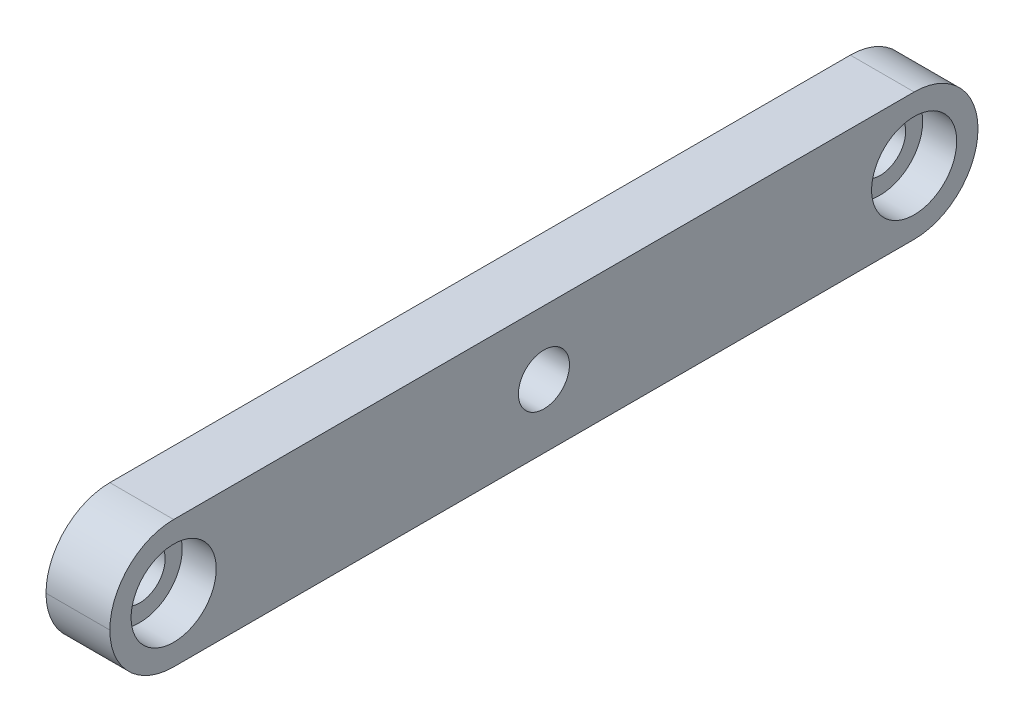
from build123d import *

# Parameters (mm, degrees)
SKETCH_1_W          = 20.4
SKETCH_1_H          = 3
SKETCH_1_R          = 0.6
EXTRUDE_1_DEPTH     = 1.5
FILLET_1_R          = 1.5
CUT_EXTRUDE_START   = 1.5
SKETCH_1_3_R        = 1
CUT_EXTRUDE_1_DEPTH = 0.8


with BuildPart() as part:
    # 草图1 → 凸台-拉伸1 (new body)
    with BuildSketch(Plane(origin=(0, 0, 0), x_dir=(0, 0, -1), z_dir=(1, 0, 0))):
        Rectangle(SKETCH_1_W, SKETCH_1_H)
        Circle(SKETCH_1_R, mode=Mode.SUBTRACT)
        with Locations((-8.7, 0)):
            Circle(SKETCH_1_R, mode=Mode.SUBTRACT)
        with Locations((8.7, 0)):
            Circle(SKETCH_1_R, mode=Mode.SUBTRACT)
    extrude(amount=EXTRUDE_1_DEPTH)

    # 圆角1
    fillet_1_edges = [part.edges().sort_by_distance(p)[0] for p in [
        (0.75, -1.5, -10.2),
        (0.75, 1.5, -10.2),
        (0.75, -1.5, 10.2),
        (0.75, 1.5, 10.2),
    ]]
    fillet(fillet_1_edges, radius=FILLET_1_R - 0.0001)  # a hair under: the kernel refuses the full size

    # 草图1<3> → 切除-拉伸1 (cut)
    with BuildSketch(Plane(origin=(0, 0, 0), x_dir=(0, 0, -1), z_dir=(1, 0, 0)).offset(CUT_EXTRUDE_START)):
        with Locations((-8.7, 0)):
            Circle(SKETCH_1_3_R)
        with Locations((8.7, 0)):
            Circle(SKETCH_1_3_R)
    extrude(amount=-CUT_EXTRUDE_1_DEPTH, mode=Mode.SUBTRACT)


solid = part.part
